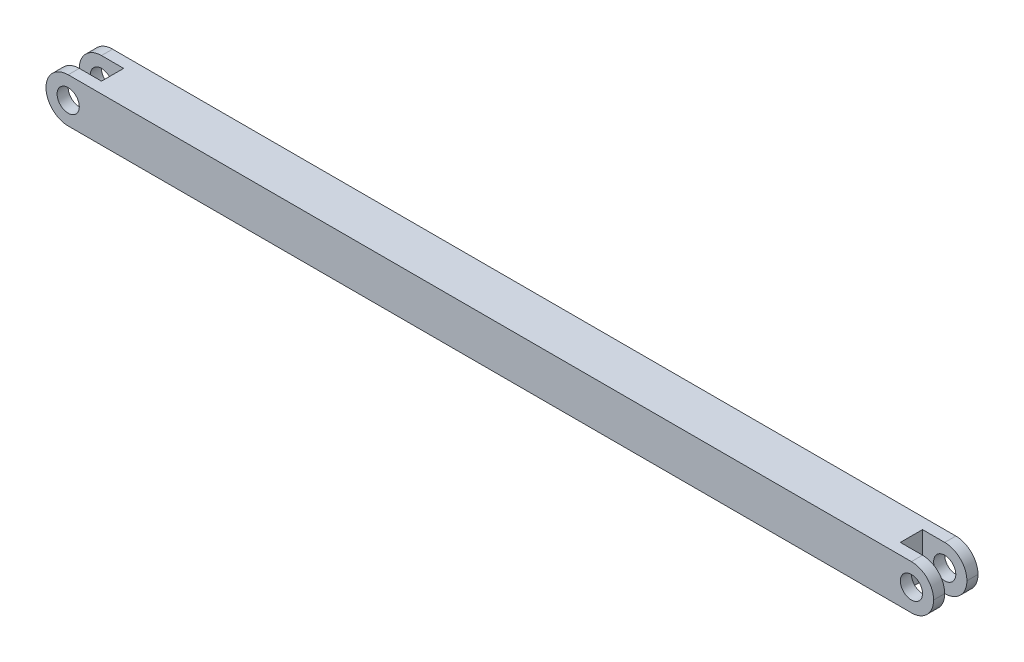
from build123d import *

# Parameters (mm, degrees)
SKETCH1_W           = 200
SKETCH1_H           = 10
BOSS_EXTRUDE1_DEPTH = 10
FILLET1_R           = 5
SKETCH2_R           = 2.5
CUT_EXTRUDE1_DEPTH  = 10
SKETCH3_W           = 10
SKETCH3_H           = 5
CUT_EXTRUDE2_DEPTH  = 10


with BuildPart() as part:
    # Sketch1 → Boss-Extrude1 (new body)
    with BuildSketch(Plane.XY):
        Rectangle(SKETCH1_W, SKETCH1_H)
    extrude(amount=BOSS_EXTRUDE1_DEPTH)

    # Fillet1
    fillet1_edges = [part.edges().sort_by_distance(p)[0] for p in [
        (-100, -5, 5),
        (-100, 5, 5),
        (100, -5, 5),
        (100, 5, 5),
    ]]
    fillet(fillet1_edges, radius=FILLET1_R - 0.0001)  # a hair under: the kernel refuses the full size

    # Sketch2 → Cut-Extrude1 (cut)
    with BuildSketch(Plane.XY.offset(10)):
        with Locations((95, 0)):
            Circle(SKETCH2_R)
        with Locations((-95, 0)):
            Circle(SKETCH2_R)
    extrude(amount=-CUT_EXTRUDE1_DEPTH, mode=Mode.SUBTRACT)

    # Sketch3 → Cut-Extrude2 (cut)
    with BuildSketch(Plane(origin=(0, 5, 0), x_dir=(1, 0, 0), z_dir=(0, 1, 0))):
        with Locations((-95, -5)):
            Rectangle(SKETCH3_W, SKETCH3_H)
        with Locations((95, -5)):
            Rectangle(SKETCH3_W, SKETCH3_H)
    extrude(amount=-CUT_EXTRUDE2_DEPTH, mode=Mode.SUBTRACT)


solid = part.part
